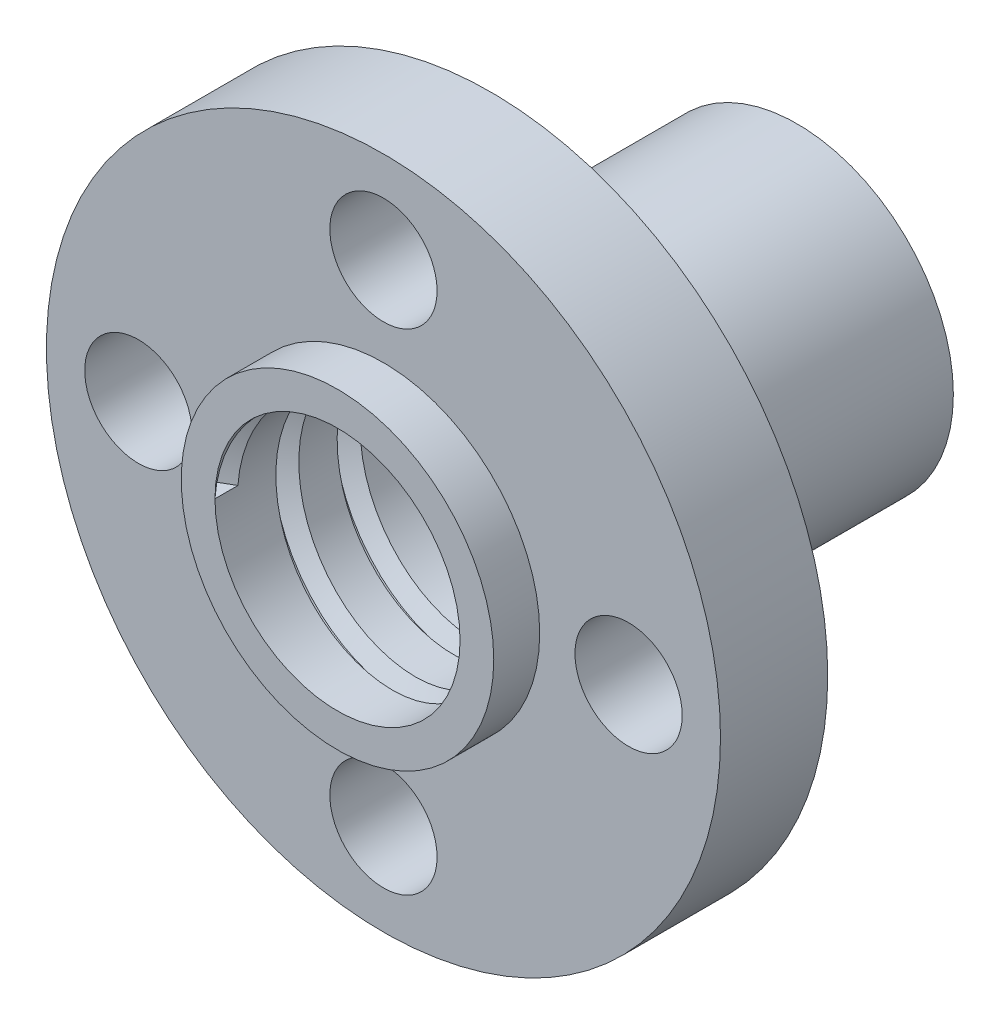
from build123d import *

# Parameters (mm, degrees)
ESBO_O1_R                  = 11
RESSALTO_EXTRUS_O1_DEPTH   = 3.5
CORTE_EXTRUS_O1_DEPTH      = 16.945218719
CORTE_EXTRUS_O1_DEPTH_BACK = 16.945218719
ESBO_O2_R                  = 1.75
ESBO_O3_R                  = 5.1
RESSALTO_EXTRUS_O2_DEPTH   = 1.5
RESSALTO_EXTRUS_O3_START   = 10
ESBO_O4_R                  = 5.1
RESSALTO_EXTRUS_O3_DEPTH   = 10
ESBO_O5_R                  = 4
CORTE_EXTRUS_O2_DEPTH      = 22.610182785
ROSCA1_PITCH               = 2


with BuildPart() as part:
    # Esboço1 → Ressalto-extrusão1 (new body)
    with BuildSketch(Plane.XY):
        Circle(ESBO_O1_R)
    extrude(amount=RESSALTO_EXTRUS_O1_DEPTH)

    # Esboço2 → Corte-extrusão1 (cut, two sides: drawn at the far end of the back side and taken through both)
    with BuildSketch(Plane.XY.offset(3.5).offset(-CORTE_EXTRUS_O1_DEPTH_BACK)):
        with Locations((0, 8)):
            Circle(ESBO_O2_R)
        with Locations((8, 0)):
            Circle(ESBO_O2_R)
        with Locations((0, -8)):
            Circle(ESBO_O2_R)
        with Locations((-8, 0)):
            Circle(ESBO_O2_R)
    extrude(amount=CORTE_EXTRUS_O1_DEPTH + CORTE_EXTRUS_O1_DEPTH_BACK, mode=Mode.SUBTRACT)

    # Esboço3 → Ressalto-extrusão2 (add)
    with BuildSketch(Plane.XY.offset(3.5)):
        Circle(ESBO_O3_R)
    extrude(amount=RESSALTO_EXTRUS_O2_DEPTH)

    # Esboço4 → Ressalto-extrusão3 (add)
    with BuildSketch(Plane(origin=(0, 0, 0), x_dir=(-1, 0, 0), z_dir=(0, 0, -1)).offset(RESSALTO_EXTRUS_O3_START)):
        with Locations(Location((0, 0, 0), (0, 0, 180))):
            Circle(ESBO_O4_R)
    extrude(amount=-RESSALTO_EXTRUS_O3_DEPTH)

    # Esboço5 → Corte-extrusão2 (cut, through all)
    with BuildSketch(Plane(origin=(0, 0, -10), x_dir=(-1, 0, 0), z_dir=(0, 0, -1))):
        Circle(ESBO_O5_R)
    extrude(amount=-CORTE_EXTRUS_O2_DEPTH, mode=Mode.SUBTRACT)

    # Rosca1: the profile of Perfil da rosca1 profile screwed along a right-hand helix of 7.5 turns, 10 arcs to a turn; built about Z, then put on its axis
    rosca1_z = Axis((0, 0, 0), (0, 0, 1))
    rosca1_corners = [(3.9997, 0, -0.000173205), (4.541265875, 0, 0.312499999), (4.541265875, 0, 0.437499999), (3.9997, 0, 0.750173202)]
    with BuildLine(mode=Mode.PRIVATE) as rosca1_profile:
        Line(rosca1_corners[0], rosca1_corners[1])
        Line(rosca1_corners[1], rosca1_corners[2])
        Line(rosca1_corners[2], rosca1_corners[3])
        Line(rosca1_corners[3], rosca1_corners[0])
    rosca1_cap = Face(rosca1_profile.wire())
    rosca1_turn_angles = [0, 18, 36, 54, 72, 90, 108, 126, 144, 162, 180, 198, 216, 234, 252, 270, 288, 306, 324, 342, 360]
    rosca1_turn_weights = [1, 0.9510565162951535, 1, 0.9510565162951535, 1, 0.9510565162951535, 1, 0.9510565162951535, 1, 0.9510565162951535, 1, 0.9510565162951535, 1, 0.9510565162951535, 1, 0.9510565162951535, 1, 0.9510565162951535, 1, 0.9510565162951535, 1]
    rosca1_turn_rails = [Edge.make_bspline([Vector(p[0], p[1], 0).rotate(rosca1_z, rosca1_turn_angles[k]) / rosca1_turn_weights[k] + Vector(0, 0, p[2] + ROSCA1_PITCH * rosca1_turn_angles[k] / 360) for k in range(21)], [0, 0, 0, 1, 1, 2, 2, 3, 3, 4, 4, 5, 5, 6, 6, 7, 7, 8, 8, 9, 9, 10, 10, 10], 2, rosca1_turn_weights) for p in rosca1_corners]
    rosca1_turn_sides = [Face.make_surface_from_curves(rosca1_turn_rails[p[0]], rosca1_turn_rails[p[1]]) for p in [(0, 1), (1, 2), (2, 3), (3, 0)]]
    rosca1_last_angles = [2520, 2538, 2556, 2574, 2592, 2610, 2628, 2646, 2664, 2682, 2700]
    rosca1_last_weights = [1, 0.9510565162951535, 1, 0.9510565162951535, 1, 0.9510565162951535, 1, 0.9510565162951535, 1, 0.9510565162951535, 1]
    rosca1_last_rails = [Edge.make_bspline([Vector(p[0], p[1], 0).rotate(rosca1_z, rosca1_last_angles[k]) / rosca1_last_weights[k] + Vector(0, 0, p[2] + ROSCA1_PITCH * rosca1_last_angles[k] / 360) for k in range(11)], [0, 0, 0, 1, 1, 2, 2, 3, 3, 4, 4, 5, 5, 5], 2, rosca1_last_weights) for p in rosca1_corners]
    rosca1_last_sides = [Face.make_surface_from_curves(rosca1_last_rails[p[0]], rosca1_last_rails[p[1]]) for p in [(0, 1), (1, 2), (2, 3), (3, 0)]]
    rosca1 = Plane(origin=(0, 0, 5), x_dir=(-1, 0, 0), z_dir=(0, 0, -1)) * Solid(Shell([*[p.moved(Location((0, 0, ROSCA1_PITCH * i))) for i in range(7) for p in rosca1_turn_sides], *rosca1_last_sides, rosca1_cap, rosca1_cap.rotate(rosca1_z, 2700).moved(Location((0, 0, ROSCA1_PITCH * 2700 / 360)))]))
    add(rosca1, mode=Mode.SUBTRACT)


solid = part.part
